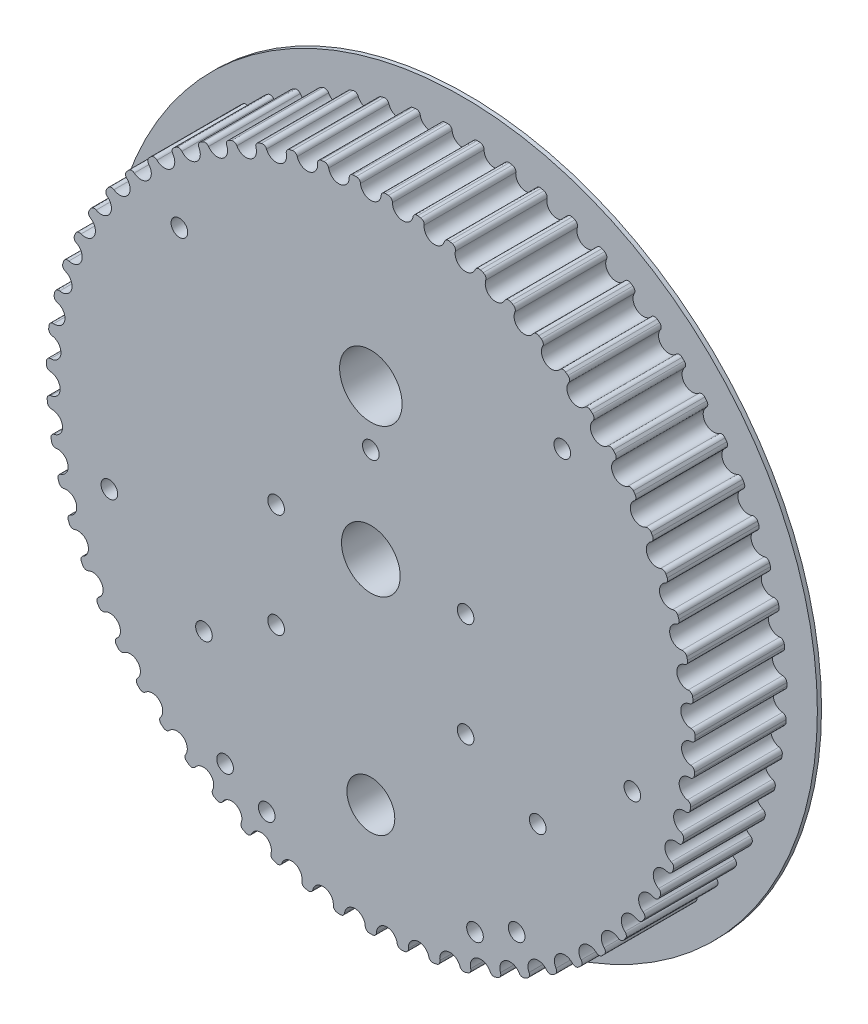
from build123d import *

# Parameters (mm, degrees)
BOSS_EXTRUDE1_DEPTH = 22
SKETCH2_R           = 85.214091318
BOSS_EXTRUDE2_DEPTH = 1
SKETCH3_R           = 7.05
SKETCH3_R_2         = 5.75
SKETCH3_R_3         = 7.5
CUT_EXTRUDE1_DEPTH  = 123.686114611
SKETCH4_R           = 2
CUT_EXTRUDE2_DEPTH  = 18


with BuildPart() as part:
    # Sketch1 → Boss-Extrude1 (new body)
    with BuildSketch(Plane.XY):
        with BuildLine():
            ThreePointArc((2.48146659, 76.908121514), (0, 74.624091318), (-2.48146659, 76.908121514))
            ThreePointArc((-2.48146659, 76.908121514), (-2.817624817, 77.57630379), (-3.523265194, 77.824379512))
            ThreePointArc((-3.523265194, 77.824379512), (-3.703241715, 77.81602306), (-3.883198428, 77.807250395))
            ThreePointArc((-3.883198428, 77.807250395), (-4.063134372, 77.798061565), (-4.243048583, 77.788456617))
            ThreePointArc((-4.243048583, 77.788456617), (-4.920482109, 77.471354546), (-5.188440419, 76.773022067))
            ThreePointArc((-5.188440419, 76.773022067), (-7.430160077, 74.253267445), (-10.12671167, 76.278873497))
            ThreePointArc((-10.12671167, 76.278873497), (-10.527728921, 76.910264875), (-11.254563179, 77.08684876))
            ThreePointArc((-11.254563179, 77.08684876), (-11.432813322, 77.060613959), (-11.611002314, 77.033966985))
            ThreePointArc((-11.611002314, 77.033966985), (-11.789129204, 77.006907981), (-11.967193036, 76.979437092))
            ThreePointArc((-11.967193036, 76.979437092), (-12.609687073, 76.596460174), (-12.806782377, 75.874917834))
            ThreePointArc((-12.806782377, 75.874917834), (-14.786475884, 73.144481241), (-17.67131294, 74.891531766))
            ThreePointArc((-17.67131294, 74.891531766), (-18.133203726, 75.479857193), (-18.874008258, 75.583194272))
            ThreePointArc((-18.874008258, 75.583194272), (-19.048760494, 75.539341854), (-19.223410843, 75.495085401))
            ThreePointArc((-19.223410843, 75.495085401), (-19.397958373, 75.450425149), (-19.572402149, 75.405361336))
            ThreePointArc((-19.572402149, 75.405361336), (-20.173571302, 74.960315769), (-20.297844778, 74.22273458))
            ThreePointArc((-20.297844778, 74.22273458), (-21.995837052, 71.30875232), (-25.040288763, 72.759884345))
            ThreePointArc((-25.040288763, 72.759884345), (-25.558462605, 73.299296781), (-26.305874964, 73.328360042))
            ThreePointArc((-26.305874964, 73.328360042), (-26.475392525, 73.267325833), (-26.644768478, 73.205899741))
            ThreePointArc((-26.644768478, 73.205899741), (-26.814001917, 73.144082094), (-26.983091936, 73.081873222))
            ThreePointArc((-26.983091936, 73.081873222), (-27.536961516, 72.579182069), (-27.587178078, 71.832892444))
            ThreePointArc((-27.587178078, 71.832892444), (-28.986593708, 68.764324982), (-32.160402946, 69.905116505))
            ThreePointArc((-32.160402946, 69.905116505), (-32.729710001, 70.390255026), (-33.476302066, 70.344755626))
            ThreePointArc((-33.476302066, 70.344755626), (-33.638900212, 70.267146211), (-33.801318434, 70.18916096))
            ThreePointArc((-33.801318434, 70.18916096), (-33.963555864, 70.11080029), (-34.125611633, 70.032064619))
            ThreePointArc((-34.125611633, 70.032064619), (-34.626677035, 69.476723849), (-34.602337609, 68.729142751))
            ThreePointArc((-34.602337609, 68.729142751), (-35.689268574, 65.536486889), (-38.960892596, 66.355600211))
            ThreePointArc((-38.960892596, 66.355600211), (-39.575674834, 66.781643292), (-40.314026638, 66.662033425))
            ThreePointArc((-40.314026638, 66.662033425), (-40.468089395, 66.568620121), (-40.621935701, 66.474850764))
            ThreePointArc((-40.621935701, 66.474850764), (-40.775564733, 66.380725854), (-40.92897567, 66.286245894))
            ThreePointArc((-40.92897567, 66.286245894), (-41.37225708, 65.683774735), (-41.273603563, 64.942331958))
            ThreePointArc((-41.273603563, 64.942331958), (-42.037247454, 61.657317745), (-45.374171391, 62.146612151))
            ThreePointArc((-45.374171391, 62.146612151), (-46.02831883, 62.509325584), (-46.751092302, 62.316793986))
            ThreePointArc((-46.751092302, 62.316793986), (-46.895088524, 62.208505178), (-47.03883392, 62.099883635))
            ThreePointArc((-47.03883392, 62.099883635), (-47.182327721, 61.990929941), (-47.325569158, 61.881644677))
            ThreePointArc((-47.325569158, 61.881644677), (-47.706661048, 61.238030757), (-47.534673901, 60.510095095))
            ThreePointArc((-47.534673901, 60.510095095), (-47.967441284, 57.165370477), (-51.336501286, 57.319983138))
            ThreePointArc((-51.336501286, 57.319983138), (-52.023512715, 57.615762115), (-52.723524606, 57.352222252))
            ThreePointArc((-52.723524606, 57.352222252), (-52.856023196, 57.230134161), (-52.988239076, 57.107739964))
            ThreePointArc((-52.988239076, 57.107739964), (-53.120171538, 56.985040316), (-53.251819879, 56.862035874))
            ThreePointArc((-53.251819879, 56.862035874), (-53.566934785, 56.183675717), (-53.323323294, 55.47648172))
            ThreePointArc((-53.323323294, 55.47648172), (-53.420913131, 52.105288075), (-56.788625967, 51.923682381))
            ThreePointArc((-56.788625967, 51.923682381), (-57.501673558, 52.149587317), (-58.171966836, 51.817658367))
            ThreePointArc((-58.171966836, 51.817658367), (-58.291650962, 51.682984359), (-58.411023305, 51.548033916))
            ThreePointArc((-58.411023305, 51.548033916), (-58.530083226, 51.412807759), (-58.648830088, 51.277306612))
            ThreePointArc((-58.648830088, 51.277306612), (-58.894836258, 50.570942066), (-58.582021544, 49.891518147))
            ThreePointArc((-58.582021544, 49.891518147), (-58.343463943, 46.52735991), (-61.67635977, 46.011340741))
            ThreePointArc((-61.67635977, 46.011340741), (-62.408356935, 46.165126492), (-63.042269924, 45.768107312))
            ThreePointArc((-63.042269924, 45.768107312), (-63.147950112, 45.622185839), (-63.253292542, 45.476020348))
            ThreePointArc((-63.253292542, 45.476020348), (-63.35829665, 45.329611621), (-63.462961876, 45.18296044))
            ThreePointArc((-63.462961876, 45.18296044), (-63.637414389, 44.455611673), (-63.258505345, 43.810710252))
            ThreePointArc((-63.258505345, 43.810710252), (-62.686171199, 40.487021939), (-65.9511262, 39.641717725))
            ThreePointArc((-65.9511262, 39.641717725), (-66.694798023, 39.721855898), (-67.286030611, 39.263692245))
            ThreePointArc((-67.286030611, 39.263692245), (-67.376656564, 39.10797354), (-67.46692214, 38.952045659))
            ThreePointArc((-67.46692214, 38.952045659), (-67.556826858, 38.795909436), (-67.646370236, 38.639565707))
            ThreePointArc((-67.646370236, 38.639565707), (-67.747535305, 37.898461439), (-67.306297699, 37.294491835))
            ThreePointArc((-67.306297699, 37.294491835), (-66.405875122, 34.044305755), (-69.570440708, 32.878117508))
            ThreePointArc((-69.570440708, 32.878117508), (-70.318396244, 32.883811655), (-70.861072497, 32.369056964))
            ThreePointArc((-70.861072497, 32.369056964), (-70.935743532, 32.20508863), (-71.010035156, 32.04094804))
            ThreePointArc((-71.010035156, 32.04094804), (-71.083946969, 31.876636074), (-71.157478577, 31.712153611))
            ThreePointArc((-71.157478577, 31.712153611), (-71.184350778, 30.964659268), (-70.685169829, 30.407624003))
            ThreePointArc((-70.685169829, 30.407624003), (-69.465607625, 27.263241965), (-72.498332921, 25.787759789))
            ThreePointArc((-72.498332921, 25.787759789), (-73.243138652, 25.718953318), (-73.731865208, 25.152723453))
            ThreePointArc((-73.731865208, 25.152723453), (-73.789839212, 24.98213508), (-73.847418539, 24.811413085))
            ThreePointArc((-73.847418539, 24.811413085), (-73.904602879, 24.640558382), (-73.961391928, 24.469571885))
            ThreePointArc((-73.961391928, 24.469571885), (-73.913704193, 23.723116402), (-73.361540984, 23.218551543))
            ThreePointArc((-73.361540984, 23.218551543), (-71.83495971, 20.211223827), (-74.70570413, 18.441111727))
            ThreePointArc((-74.70570413, 18.441111727), (-75.439957841, 18.298488468), (-75.869877517, 17.686410876))
            ThreePointArc((-75.869877517, 17.686410876), (-75.910578319, 17.510897847), (-75.950873099, 17.335291159))
            ThreePointArc((-75.950873099, 17.335291159), (-75.990761643, 17.15959175), (-76.030243737, 16.98380056))
            ThreePointArc((-76.030243737, 16.98380056), (-75.908470008, 16.245802548), (-75.308812185, 15.798722686))
            ThreePointArc((-75.308812185, 15.798722686), (-73.490383692, 12.958337467), (-76.170616488, 10.911187612))
            ThreePointArc((-76.170616488, 10.911187612), (-76.887020837, 10.696165019), (-77.253860898, 10.044322801))
            ThreePointArc((-77.253860898, 10.044322801), (-77.276883994, 9.865629445), (-77.299493761, 9.686883322))
            ThreePointArc((-77.299493761, 9.686883322), (-77.321690077, 9.508085386), (-77.343472825, 9.329236595))
            ThreePointArc((-77.343472825, 9.329236595), (-77.148823344, 8.607030608), (-76.507630577, 8.221879025))
            ThreePointArc((-76.507630577, 8.221879025), (-74.415427224, 5.576665328), (-76.878511038, 3.272823212))
            ThreePointArc((-76.878511038, 3.272823212), (-77.569946077, 2.987538276), (-77.870060701, 2.302409734))
            ThreePointArc((-77.870060701, 2.302409734), (-77.875177277, 2.122311986), (-77.879877325, 1.942202886))
            ThreePointArc((-77.879877325, 1.942202886), (-77.884160817, 1.762083398), (-77.888027733, 1.581954485))
            ThreePointArc((-77.888027733, 1.581954485), (-77.622437014, 0.882718132), (-76.946081764, 0.563322636))
            ThreePointArc((-76.946081764, 0.563322636), (-74.600896808, -1.860430217), (-76.822352407, -4.398067976))
            ThreePointArc((-76.822352407, -4.398067976), (-77.481946343, -4.750779964), (-77.712352856, -5.462385715))
            ThreePointArc((-77.712352856, -5.462385715), (-77.699512062, -5.642097964), (-77.686255679, -5.821780035))
            ThreePointArc((-77.686255679, -5.821780035), (-77.672583776, -6.001430967), (-77.658496428, -6.181049799))
            ThreePointArc((-77.658496428, -6.181049799), (-77.324604031, -6.850367194), (-76.619808221, -7.100832306))
            ThreePointArc((-76.619808221, -7.100832306), (-74.044949163, -9.27903597), (-76.002698723, -12.025249187))
            ThreePointArc((-76.002698723, -12.025249187), (-76.623896215, -12.441882819), (-76.782304735, -13.172893522))
            ThreePointArc((-76.782304735, -13.172893522), (-76.751634188, -13.350434209), (-76.720553122, -13.52790349))
            ThreePointArc((-76.720553122, -13.52790349), (-76.689061702, -13.705300415), (-76.657160097, -13.882624034))
            ThreePointArc((-76.657160097, -13.882624034), (-76.258284394, -14.515370493), (-75.532052601, -14.694415986))
            ThreePointArc((-75.532052601, -14.694415986), (-72.753109547, -16.605422496), (-74.427696074, -19.53291807))
            ThreePointArc((-74.427696074, -19.53291807), (-75.004323383, -20.009332652), (-75.089159573, -20.752483194))
            ThreePointArc((-75.089159573, -20.752483194), (-75.040964091, -20.926087842), (-74.99236724, -21.099580563))
            ThreePointArc((-74.99236724, -21.099580563), (-74.943369278, -21.272960429), (-74.893970468, -21.446226513))
            ThreePointArc((-74.893970468, -21.446226513), (-74.434075667, -22.036113518), (-73.693625507, -22.141959958))
            ThreePointArc((-73.693625507, -22.141959958), (-70.738216844, -23.766776872), (-72.112997543, -26.846460038))
            ThreePointArc((-72.112997543, -26.846460038), (-72.639323888, -27.377920748), (-72.649744609, -28.125825364))
            ThreePointArc((-72.649744609, -28.125825364), (-72.58450318, -28.293768612), (-72.51887352, -28.461560525))
            ThreePointArc((-72.51887352, -28.461560525), (-72.45285598, -28.629200206), (-72.386450914, -28.796686759))
            ThreePointArc((-72.386450914, -28.796686759), (-71.870107654, -29.337851747), (-71.122798056, -29.369447185))
            ThreePointArc((-71.122798056, -29.369447185), (-68.02029596, -30.691926342), (-69.081607645, -33.893189824))
            ThreePointArc((-69.081607645, -33.893189824), (-69.552402157, -34.474414767), (-69.488303843, -35.219640447))
            ThreePointArc((-69.488303843, -35.219640447), (-69.406664866, -35.380253197), (-69.324654655, -35.540676711))
            ThreePointArc((-69.324654655, -35.540676711), (-69.242273649, -35.700910129), (-69.159522289, -35.860952594))
            ThreePointArc((-69.159522289, -35.860952594), (-68.591862222, -36.348017226), (-67.845120284, -36.305047651))
            ThreePointArc((-67.845120284, -36.305047651), (-64.626358816, -37.312045659), (-65.363653693, -40.603073863))
            ThreePointArc((-65.363653693, -40.603073863), (-65.774237406, -41.228286564), (-65.636257094, -41.963426919))
            ThreePointArc((-65.636257094, -41.963426919), (-65.539031934, -42.115112932), (-65.441456227, -42.266573685))
            ThreePointArc((-65.441456227, -42.266573685), (-65.343530494, -42.417808367), (-65.24525526, -42.56881617))
            ThreePointArc((-65.24525526, -42.56881617), (-64.631920047, -42.996939778), (-63.893167225, -42.879832242))
            ThreePointArc((-63.893167225, -42.879832242), (-60.590135883, -43.561341103), (-60.996086385, -46.909426312))
            ThreePointArc((-60.996086385, -46.909426312), (-61.342378733, -47.572413127), (-61.131887735, -48.290162002))
            ThreePointArc((-61.131887735, -48.290162002), (-61.020042658, -48.431413753), (-60.907871206, -48.57240646))
            ThreePointArc((-60.907871206, -48.57240646), (-60.795373976, -48.713139369), (-60.682551572, -48.853611727))
            ThreePointArc((-60.682551572, -48.853611727), (-60.029636814, -49.218539426), (-59.306215166, -49.028457797))
            ThreePointArc((-59.306215166, -49.028457797), (-55.951740959, -49.377704369), (-56.022312567, -52.749571807))
            ThreePointArc((-56.022312567, -52.749571807), (-56.300871941, -53.443743675), (-56.01996221, -54.136967759))
            ThreePointArc((-56.01996221, -54.136967759), (-55.894608784, -54.266381425), (-55.768956396, -54.395504838))
            ThreePointArc((-55.768956396, -54.395504838), (-55.643005719, -54.524337307), (-55.516757424, -54.652878142))
            ThreePointArc((-55.516757424, -54.652878142), (-54.830752081, -54.950983117), (-54.129851296, -54.68981651))
            ThreePointArc((-54.129851296, -54.68981651), (-50.757272496, -54.703329824), (-50.491763838, -58.065468359))
            ThreePointArc((-50.491763838, -58.065468359), (-50.699821789, -58.783926288), (-50.351285133, -59.445736009))
            ThreePointArc((-50.351285133, -59.445736009), (-50.213669176, -59.562025419), (-50.075784643, -59.677996251))
            ThreePointArc((-50.075784643, -59.677996251), (-49.937632271, -59.793647884), (-49.799212798, -59.908979701))
            ThreePointArc((-49.799212798, -59.908979701), (-49.0869347, -60.13729925), (-48.415520645, -59.807643257))
            ThreePointArc((-48.415520645, -59.807643257), (-45.058355455, -59.485289012), (-44.459405275, -62.8042842))
            ThreePointArc((-44.459405275, -62.8042842), (-44.594894031, -63.539887832), (-44.182194362, -64.163705827))
            ThreePointArc((-44.182194362, -64.163705827), (-44.033683565, -64.265715244), (-43.884937245, -64.367380925))
            ThreePointArc((-43.884937245, -64.367380925), (-43.735956199, -64.468702325), (-43.586741223, -64.569678903))
            ThreePointArc((-43.586741223, -64.569678903), (-42.855269308, -64.725943885), (-42.220014798, -64.331074775))
            ThreePointArc((-42.220014798, -64.331074775), (-38.911628234, -63.676056672), (-37.985189168, -66.918922847))
            ThreePointArc((-37.985189168, -66.918922847), (-38.04676218, -67.664361424), (-37.574001095, -68.24398791))
            ThreePointArc((-37.574001095, -68.24398791), (-37.416071423, -68.330703519), (-37.257941624, -68.41705365))
            ThreePointArc((-37.257941624, -68.41705365), (-37.099612544, -68.503037839), (-36.941085031, -68.588655628))
            ThreePointArc((-36.941085031, -68.588655628), (-36.197688996, -68.671313011), (-35.604907476, -68.21515517))
            ThreePointArc((-35.604907476, -68.21515517), (-32.378179769, -67.233983073), (-31.133459186, -70.368491176))
            ThreePointArc((-31.133459186, -70.368491176), (-31.120504514, -71.116356192), (-30.592380524, -71.646030581))
            ThreePointArc((-30.592380524, -71.646030581), (-30.426601553, -71.716590564), (-30.26065984, -71.786766957))
            ThreePointArc((-30.26065984, -71.786766957), (-30.094556273, -71.856559387), (-29.928291739, -71.925967478))
            ThreePointArc((-29.928291739, -71.925967478), (-29.180359789, -71.934195776), (-28.635942587, -71.421282706))
            ThreePointArc((-28.635942587, -71.421282706), (-25.522942408, -70.123707945), (-23.972310899, -73.118705824))
            ThreePointArc((-23.972310899, -73.118705824), (-23.884957293, -73.861564663), (-23.306719131, -74.336022812))
            ThreePointArc((-23.306719131, -74.336022812), (-23.134738447, -74.389725911), (-22.962634024, -74.443031123))
            ThreePointArc((-22.962634024, -74.443031123), (-22.790406781, -74.495938164), (-22.618057639, -74.54844675))
            ThreePointArc((-22.618057639, -74.54844675), (-21.873023056, -74.482164185), (-21.382380835, -73.917593447))
            ThreePointArc((-21.382380835, -73.917593447), (-18.414046579, -72.316511902), (-16.572915017, -75.142233924))
            ThreePointArc((-16.572915017, -75.142233924), (-16.412030635, -75.87270372), (-15.789425092, -76.287230251))
            ThreePointArc((-15.789425092, -76.287230251), (-15.612951917, -76.323542741), (-15.436395234, -76.359447001))
            ThreePointArc((-15.436395234, -76.359447001), (-15.259755987, -76.394942839), (-15.083035119, -76.430030065))
            ThreePointArc((-15.083035119, -76.430030065), (-14.348302394, -76.289895384), (-13.916311377, -75.679277936))
            ThreePointArc((-13.916311377, -75.679277936), (-11.122143681, -73.790601875), (-9.008810059, -76.418964744))
            ThreePointArc((-9.008810059, -76.418964744), (-8.775993843, -77.12978576), (-8.115208653, -77.480260923))
            ThreePointArc((-8.115208653, -77.480260923), (-7.935996857, -77.498821914), (-7.756742614, -77.516968389))
            ThreePointArc((-7.756742614, -77.516968389), (-7.577446882, -77.53470025), (-7.398110621, -77.552017404))
            ThreePointArc((-7.398110621, -77.552017404), (-6.680981856, -77.339423328), (-6.311935363, -76.68882776))
            ThreePointArc((-6.311935363, -76.68882776), (-3.719703923, -74.531327694), (-1.355171499, -76.93620956))
            ThreePointArc((-1.355171499, -76.93620956), (-1.052737282, -77.620317337), (-0.360339625, -77.903257952))
            ThreePointArc((-0.360339625, -77.903257952), (-0.180170294, -77.903882976), (0, -77.904091318))
            ThreePointArc((0, -77.904091318), (0.180170294, -77.903882976), (0.360339625, -77.903257952))
            ThreePointArc((0.360339625, -77.903257952), (1.052737282, -77.620317337), (1.355171499, -76.93620956))
            ThreePointArc((1.355171499, -76.93620956), (3.719703923, -74.531327694), (6.311935363, -76.68882776))
            ThreePointArc((6.311935363, -76.68882776), (6.680981856, -77.339423328), (7.398110621, -77.552017404))
            ThreePointArc((7.398110621, -77.552017404), (7.577446882, -77.53470025), (7.756742614, -77.516968389))
            ThreePointArc((7.756742614, -77.516968389), (7.935996857, -77.498821914), (8.115208653, -77.480260923))
            ThreePointArc((8.115208653, -77.480260923), (8.775993843, -77.12978576), (9.008810059, -76.418964744))
            ThreePointArc((9.008810059, -76.418964744), (11.122143681, -73.790601875), (13.916311377, -75.679277936))
            ThreePointArc((13.916311377, -75.679277936), (14.348302394, -76.289895384), (15.083035119, -76.430030065))
            ThreePointArc((15.083035119, -76.430030065), (15.259755987, -76.394942839), (15.436395234, -76.359447001))
            ThreePointArc((15.436395234, -76.359447001), (15.612951917, -76.323542741), (15.789425092, -76.287230251))
            ThreePointArc((15.789425092, -76.287230251), (16.412030635, -75.87270372), (16.572915017, -75.142233924))
            ThreePointArc((16.572915017, -75.142233924), (18.414046579, -72.316511902), (21.382380835, -73.917593447))
            ThreePointArc((21.382380835, -73.917593447), (21.873023056, -74.482164185), (22.618057639, -74.54844675))
            ThreePointArc((22.618057639, -74.54844675), (22.79040678, -74.495938164), (22.962634024, -74.443031123))
            ThreePointArc((22.962634024, -74.443031123), (23.134738447, -74.389725911), (23.306719131, -74.336022812))
            ThreePointArc((23.306719131, -74.336022812), (23.884957293, -73.861564663), (23.972310899, -73.118705824))
            ThreePointArc((23.972310899, -73.118705824), (25.522942408, -70.123707945), (28.635942587, -71.421282706))
            ThreePointArc((28.635942587, -71.421282706), (29.180359789, -71.934195776), (29.928291739, -71.925967478))
            ThreePointArc((29.928291739, -71.925967478), (30.094556273, -71.856559387), (30.26065984, -71.786766957))
            ThreePointArc((30.26065984, -71.786766957), (30.426601553, -71.716590564), (30.592380524, -71.646030581))
            ThreePointArc((30.592380524, -71.646030581), (31.120504514, -71.116356192), (31.133459186, -70.368491176))
            ThreePointArc((31.133459186, -70.368491176), (32.378179769, -67.233983073), (35.604907476, -68.21515517))
            ThreePointArc((35.604907476, -68.21515517), (36.197688996, -68.671313011), (36.941085031, -68.588655628))
            ThreePointArc((36.941085031, -68.588655628), (37.099612544, -68.503037839), (37.257941624, -68.41705365))
            ThreePointArc((37.257941624, -68.41705365), (37.416071423, -68.330703519), (37.574001095, -68.24398791))
            ThreePointArc((37.574001095, -68.24398791), (38.04676218, -67.664361424), (37.985189168, -66.918922847))
            ThreePointArc((37.985189168, -66.918922847), (38.911628234, -63.676056672), (42.220014798, -64.331074775))
            ThreePointArc((42.220014798, -64.331074775), (42.855269308, -64.725943885), (43.586741223, -64.569678903))
            ThreePointArc((43.586741223, -64.569678903), (43.735956199, -64.468702325), (43.884937245, -64.367380925))
            ThreePointArc((43.884937245, -64.367380925), (44.033683565, -64.265715244), (44.182194362, -64.163705827))
            ThreePointArc((44.182194362, -64.163705827), (44.594894031, -63.539887832), (44.459405275, -62.8042842))
            ThreePointArc((44.459405275, -62.8042842), (45.058355455, -59.485289012), (48.415520645, -59.807643257))
            ThreePointArc((48.415520645, -59.807643257), (49.0869347, -60.13729925), (49.799212798, -59.908979701))
            ThreePointArc((49.799212798, -59.908979701), (49.937632271, -59.793647884), (50.075784643, -59.677996251))
            ThreePointArc((50.075784643, -59.677996251), (50.213669176, -59.562025419), (50.351285133, -59.445736009))
            ThreePointArc((50.351285133, -59.445736009), (50.699821789, -58.783926288), (50.491763838, -58.065468359))
            ThreePointArc((50.491763838, -58.065468359), (50.757272496, -54.703329824), (54.129851296, -54.68981651))
            ThreePointArc((54.129851296, -54.68981651), (54.830752081, -54.950983117), (55.516757424, -54.652878142))
            ThreePointArc((55.516757424, -54.652878142), (55.643005719, -54.524337307), (55.768956396, -54.395504838))
            ThreePointArc((55.768956396, -54.395504838), (55.894608784, -54.266381425), (56.01996221, -54.136967759))
            ThreePointArc((56.01996221, -54.136967759), (56.300871941, -53.443743675), (56.022312567, -52.749571807))
            ThreePointArc((56.022312567, -52.749571807), (55.951740959, -49.377704369), (59.306215166, -49.028457797))
            ThreePointArc((59.306215166, -49.028457797), (60.029636814, -49.218539426), (60.682551572, -48.853611727))
            ThreePointArc((60.682551572, -48.853611727), (60.795373976, -48.713139369), (60.907871206, -48.57240646))
            ThreePointArc((60.907871206, -48.57240646), (61.020042658, -48.431413753), (61.131887735, -48.290162002))
            ThreePointArc((61.131887735, -48.290162002), (61.342378733, -47.572413127), (60.996086385, -46.909426312))
            ThreePointArc((60.996086385, -46.909426312), (60.590135883, -43.561341103), (63.893167225, -42.879832242))
            ThreePointArc((63.893167225, -42.879832242), (64.631920047, -42.996939778), (65.24525526, -42.56881617))
            ThreePointArc((65.24525526, -42.56881617), (65.343530494, -42.417808367), (65.441456227, -42.266573685))
            ThreePointArc((65.441456227, -42.266573685), (65.539031934, -42.115112932), (65.636257094, -41.963426919))
            ThreePointArc((65.636257094, -41.963426919), (65.774237406, -41.228286564), (65.363653693, -40.603073863))
            ThreePointArc((65.363653693, -40.603073863), (64.626358816, -37.312045659), (67.845120284, -36.305047651))
            ThreePointArc((67.845120284, -36.305047651), (68.591862222, -36.348017226), (69.159522289, -35.860952594))
            ThreePointArc((69.159522289, -35.860952594), (69.242273649, -35.700910129), (69.324654655, -35.540676711))
            ThreePointArc((69.324654655, -35.540676711), (69.406664866, -35.380253197), (69.488303843, -35.219640447))
            ThreePointArc((69.488303843, -35.219640447), (69.552402157, -34.474414767), (69.081607645, -33.893189824))
            ThreePointArc((69.081607645, -33.893189824), (68.02029596, -30.691926342), (71.122798056, -29.369447185))
            ThreePointArc((71.122798056, -29.369447185), (71.870107654, -29.337851747), (72.386450914, -28.796686759))
            ThreePointArc((72.386450914, -28.796686759), (72.45285598, -28.629200206), (72.51887352, -28.461560525))
            ThreePointArc((72.51887352, -28.461560525), (72.58450318, -28.293768612), (72.649744609, -28.125825364))
            ThreePointArc((72.649744609, -28.125825364), (72.639323888, -27.377920748), (72.112997543, -26.846460038))
            ThreePointArc((72.112997543, -26.846460038), (70.738216844, -23.766776872), (73.693625507, -22.141959958))
            ThreePointArc((73.693625507, -22.141959958), (74.434075667, -22.036113518), (74.893970468, -21.446226513))
            ThreePointArc((74.893970468, -21.446226513), (74.943369278, -21.272960429), (74.99236724, -21.099580563))
            ThreePointArc((74.99236724, -21.099580563), (75.040964091, -20.926087842), (75.089159573, -20.752483194))
            ThreePointArc((75.089159573, -20.752483194), (75.004323383, -20.009332652), (74.427696074, -19.53291807))
            ThreePointArc((74.427696074, -19.53291807), (72.753109547, -16.605422496), (75.532052601, -14.694415986))
            ThreePointArc((75.532052601, -14.694415986), (76.258284394, -14.515370493), (76.657160097, -13.882624034))
            ThreePointArc((76.657160097, -13.882624034), (76.689061702, -13.705300415), (76.720553122, -13.52790349))
            ThreePointArc((76.720553122, -13.52790349), (76.751634188, -13.350434209), (76.782304735, -13.172893522))
            ThreePointArc((76.782304735, -13.172893522), (76.623896215, -12.441882819), (76.002698723, -12.025249187))
            ThreePointArc((76.002698723, -12.025249187), (74.044949163, -9.27903597), (76.619808221, -7.100832306))
            ThreePointArc((76.619808221, -7.100832306), (77.324604031, -6.850367194), (77.658496428, -6.181049799))
            ThreePointArc((77.658496428, -6.181049799), (77.672583776, -6.001430967), (77.686255679, -5.821780035))
            ThreePointArc((77.686255679, -5.821780035), (77.699512062, -5.642097964), (77.712352856, -5.462385715))
            ThreePointArc((77.712352856, -5.462385715), (77.481946343, -4.750779964), (76.822352407, -4.398067976))
            ThreePointArc((76.822352407, -4.398067976), (74.600896808, -1.860430217), (76.946081764, 0.563322636))
            ThreePointArc((76.946081764, 0.563322636), (77.622437014, 0.882718132), (77.888027733, 1.581954485))
            ThreePointArc((77.888027733, 1.581954485), (77.884160817, 1.762083398), (77.879877325, 1.942202886))
            ThreePointArc((77.879877325, 1.942202886), (77.875177277, 2.122311986), (77.870060701, 2.302409734))
            ThreePointArc((77.870060701, 2.302409734), (77.569946077, 2.987538276), (76.878511038, 3.272823212))
            ThreePointArc((76.878511038, 3.272823212), (74.415427224, 5.576665328), (76.507630577, 8.221879025))
            ThreePointArc((76.507630577, 8.221879025), (77.148823344, 8.607030608), (77.343472825, 9.329236595))
            ThreePointArc((77.343472825, 9.329236595), (77.321690077, 9.508085386), (77.299493761, 9.686883322))
            ThreePointArc((77.299493761, 9.686883322), (77.276883994, 9.865629445), (77.253860898, 10.044322801))
            ThreePointArc((77.253860898, 10.044322801), (76.887020837, 10.696165019), (76.170616488, 10.911187612))
            ThreePointArc((76.170616488, 10.911187612), (73.490383692, 12.958337467), (75.308812185, 15.798722686))
            ThreePointArc((75.308812185, 15.798722686), (75.908470008, 16.245802548), (76.030243737, 16.98380056))
            ThreePointArc((76.030243737, 16.98380056), (75.990761643, 17.15959175), (75.950873099, 17.335291159))
            ThreePointArc((75.950873099, 17.335291159), (75.910578319, 17.510897847), (75.869877517, 17.686410876))
            ThreePointArc((75.869877517, 17.686410876), (75.439957841, 18.298488468), (74.70570413, 18.441111727))
            ThreePointArc((74.70570413, 18.441111727), (71.83495971, 20.211223827), (73.361540984, 23.218551543))
            ThreePointArc((73.361540984, 23.218551543), (73.913704193, 23.723116402), (73.961391928, 24.469571885))
            ThreePointArc((73.961391928, 24.469571885), (73.904602879, 24.640558382), (73.847418539, 24.811413085))
            ThreePointArc((73.847418539, 24.811413085), (73.789839212, 24.98213508), (73.731865208, 25.152723453))
            ThreePointArc((73.731865208, 25.152723453), (73.243138652, 25.718953318), (72.498332921, 25.787759789))
            ThreePointArc((72.498332921, 25.787759789), (69.465607625, 27.263241965), (70.685169829, 30.407624003))
            ThreePointArc((70.685169829, 30.407624003), (71.184350778, 30.964659268), (71.157478577, 31.712153611))
            ThreePointArc((71.157478577, 31.712153611), (71.083946969, 31.876636074), (71.010035156, 32.04094804))
            ThreePointArc((71.010035156, 32.04094804), (70.935743532, 32.20508863), (70.861072497, 32.369056964))
            ThreePointArc((70.861072497, 32.369056964), (70.318396244, 32.883811655), (69.570440708, 32.878117508))
            ThreePointArc((69.570440708, 32.878117508), (66.405875122, 34.044305755), (67.306297699, 37.294491835))
            ThreePointArc((67.306297699, 37.294491835), (67.747535305, 37.898461439), (67.646370236, 38.639565707))
            ThreePointArc((67.646370236, 38.639565707), (67.556826858, 38.795909436), (67.46692214, 38.952045659))
            ThreePointArc((67.46692214, 38.952045659), (67.376656564, 39.10797354), (67.286030611, 39.263692245))
            ThreePointArc((67.286030611, 39.263692245), (66.694798023, 39.721855898), (65.9511262, 39.641717725))
            ThreePointArc((65.9511262, 39.641717725), (62.686171199, 40.487021939), (63.258505345, 43.810710252))
            ThreePointArc((63.258505345, 43.810710252), (63.637414389, 44.455611673), (63.462961876, 45.18296044))
            ThreePointArc((63.462961876, 45.18296044), (63.35829665, 45.329611621), (63.253292542, 45.476020348))
            ThreePointArc((63.253292542, 45.476020348), (63.147950112, 45.622185839), (63.042269924, 45.768107312))
            ThreePointArc((63.042269924, 45.768107312), (62.408356935, 46.165126492), (61.67635977, 46.011340741))
            ThreePointArc((61.67635977, 46.011340741), (58.343463943, 46.52735991), (58.582021544, 49.891518147))
            ThreePointArc((58.582021544, 49.891518147), (58.894836258, 50.570942066), (58.648830088, 51.277306612))
            ThreePointArc((58.648830088, 51.277306612), (58.530083226, 51.412807759), (58.411023305, 51.548033916))
            ThreePointArc((58.411023305, 51.548033916), (58.291650962, 51.682984359), (58.171966836, 51.817658367))
            ThreePointArc((58.171966836, 51.817658367), (57.501673558, 52.149587317), (56.788625967, 51.923682381))
            ThreePointArc((56.788625967, 51.923682381), (53.420913131, 52.105288075), (53.323323294, 55.47648172))
            ThreePointArc((53.323323294, 55.47648172), (53.566934785, 56.183675717), (53.251819879, 56.862035874))
            ThreePointArc((53.251819879, 56.862035874), (53.120171538, 56.985040316), (52.988239076, 57.107739964))
            ThreePointArc((52.988239076, 57.107739964), (52.856023196, 57.230134161), (52.723524606, 57.352222252))
            ThreePointArc((52.723524606, 57.352222252), (52.023512715, 57.615762115), (51.336501286, 57.319983138))
            ThreePointArc((51.336501286, 57.319983138), (47.967441284, 57.165370477), (47.534673901, 60.510095095))
            ThreePointArc((47.534673901, 60.510095095), (47.706661048, 61.238030757), (47.325569158, 61.881644677))
            ThreePointArc((47.325569158, 61.881644677), (47.182327721, 61.990929941), (47.03883392, 62.099883635))
            ThreePointArc((47.03883392, 62.099883635), (46.895088524, 62.208505178), (46.751092302, 62.316793986))
            ThreePointArc((46.751092302, 62.316793986), (46.02831883, 62.509325584), (45.374171391, 62.146612151))
            ThreePointArc((45.374171391, 62.146612151), (42.037247454, 61.657317745), (41.273603563, 64.942331958))
            ThreePointArc((41.273603563, 64.942331958), (41.37225708, 65.683774735), (40.92897567, 66.286245894))
            ThreePointArc((40.92897567, 66.286245894), (40.775564733, 66.380725854), (40.621935701, 66.474850764))
            ThreePointArc((40.621935701, 66.474850764), (40.468089395, 66.568620121), (40.314026638, 66.662033425))
            ThreePointArc((40.314026638, 66.662033425), (39.575674834, 66.781643292), (38.960892596, 66.355600211))
            ThreePointArc((38.960892596, 66.355600211), (35.689268574, 65.536486889), (34.602337609, 68.729142751))
            ThreePointArc((34.602337609, 68.729142751), (34.626677035, 69.476723849), (34.125611633, 70.032064619))
            ThreePointArc((34.125611633, 70.032064619), (33.963555864, 70.11080029), (33.801318434, 70.18916096))
            ThreePointArc((33.801318434, 70.18916096), (33.638900212, 70.267146211), (33.476302066, 70.344755626))
            ThreePointArc((33.476302066, 70.344755626), (32.729710001, 70.390255026), (32.160402946, 69.905116505))
            ThreePointArc((32.160402946, 69.905116505), (28.986593708, 68.764324982), (27.587178078, 71.832892444))
            ThreePointArc((27.587178078, 71.832892444), (27.536961516, 72.579182069), (26.983091936, 73.081873222))
            ThreePointArc((26.983091936, 73.081873222), (26.814001917, 73.144082094), (26.644768478, 73.205899741))
            ThreePointArc((26.644768478, 73.205899741), (26.475392525, 73.267325833), (26.305874964, 73.328360042))
            ThreePointArc((26.305874964, 73.328360042), (25.558462605, 73.299296781), (25.040288763, 72.759884345))
            ThreePointArc((25.040288763, 72.759884345), (21.995837052, 71.30875232), (20.297844778, 74.22273458))
            ThreePointArc((20.297844778, 74.22273458), (20.173571302, 74.960315769), (19.572402149, 75.405361336))
            ThreePointArc((19.572402149, 75.405361336), (19.397958373, 75.450425149), (19.223410843, 75.495085401))
            ThreePointArc((19.223410843, 75.495085401), (19.048760494, 75.539341854), (18.874008258, 75.583194272))
            ThreePointArc((18.874008258, 75.583194272), (18.133203726, 75.479857193), (17.67131294, 74.891531766))
            ThreePointArc((17.67131294, 74.891531766), (14.786475884, 73.144481241), (12.806782377, 75.874917834))
            ThreePointArc((12.806782377, 75.874917834), (12.609687073, 76.596460174), (11.967193036, 76.979437092))
            ThreePointArc((11.967193036, 76.979437092), (11.789129204, 77.006907981), (11.611002314, 77.033966985))
            ThreePointArc((11.611002314, 77.033966985), (11.432813322, 77.060613959), (11.254563179, 77.08684876))
            ThreePointArc((11.254563179, 77.08684876), (10.527728921, 76.910264875), (10.12671167, 76.278873497))
            ThreePointArc((10.12671167, 76.278873497), (7.430160077, 74.253267445), (5.188440419, 76.773022067))
            ThreePointArc((5.188440419, 76.773022067), (4.920482109, 77.471354546), (4.243048583, 77.788456617))
            ThreePointArc((4.243048583, 77.788456617), (4.063134372, 77.798061565), (3.883198428, 77.807250395))
            ThreePointArc((3.883198428, 77.807250395), (3.703241715, 77.81602306), (3.523265194, 77.824379512))
            ThreePointArc((3.523265194, 77.824379512), (2.817624817, 77.57630379), (2.48146659, 76.908121514))
        make_face()
    extrude(amount=BOSS_EXTRUDE1_DEPTH)

    # Sketch2 → Boss-Extrude2 (add)
    with BuildSketch(Plane(origin=(0, 0, 0), x_dir=(-1, 0, 0), z_dir=(0, 0, -1))):
        Circle(SKETCH2_R)
    extrude(amount=BOSS_EXTRUDE2_DEPTH)

    # Sketch3 → Cut-Extrude1 (cut, through all)
    with BuildSketch(Plane.XY.offset(22)):
        Circle(SKETCH3_R)
        with Locations((0, -51.05)):
            Circle(SKETCH3_R_2)
        with Locations((0, 36)):
            Circle(SKETCH3_R_3)
    extrude(amount=-CUT_EXTRUDE1_DEPTH, mode=Mode.SUBTRACT)

    # Sketch4 → Cut-Extrude2 (cut)
    with BuildSketch(Plane.XY.offset(22)):
        with Locations((-45.961940777, 45.961940777)):
            Circle(SKETCH4_R)
        with Locations((45.961940777, 45.961940777)):
            Circle(SKETCH4_R)
        with Locations((-25, -65)):
            Circle(SKETCH4_R)
        with Locations((25, -65)):
            Circle(SKETCH4_R)
        with Locations((-62.785178709, -16.823237932)):
            Circle(SKETCH4_R)
        with Locations((62.785178709, -16.823237932)):
            Circle(SKETCH4_R)
        with Locations((-35, -60)):
            Circle(SKETCH4_R)
        with Locations((35, -60)):
            Circle(SKETCH4_R)
        with Locations((-22.75, 0)):
            Circle(SKETCH4_R)
        with Locations((22.75, 0)):
            Circle(SKETCH4_R)
        with Locations((0, 22.75)):
            Circle(SKETCH4_R)
        with Locations((-22.75, -25)):
            Circle(SKETCH4_R)
        with Locations((22.75, -25)):
            Circle(SKETCH4_R)
        with Locations((-40.070508076, -35)):
            Circle(SKETCH4_R)
        with Locations((40.070508076, -35)):
            Circle(SKETCH4_R)
    extrude(amount=-CUT_EXTRUDE2_DEPTH, mode=Mode.SUBTRACT)


solid = part.part
